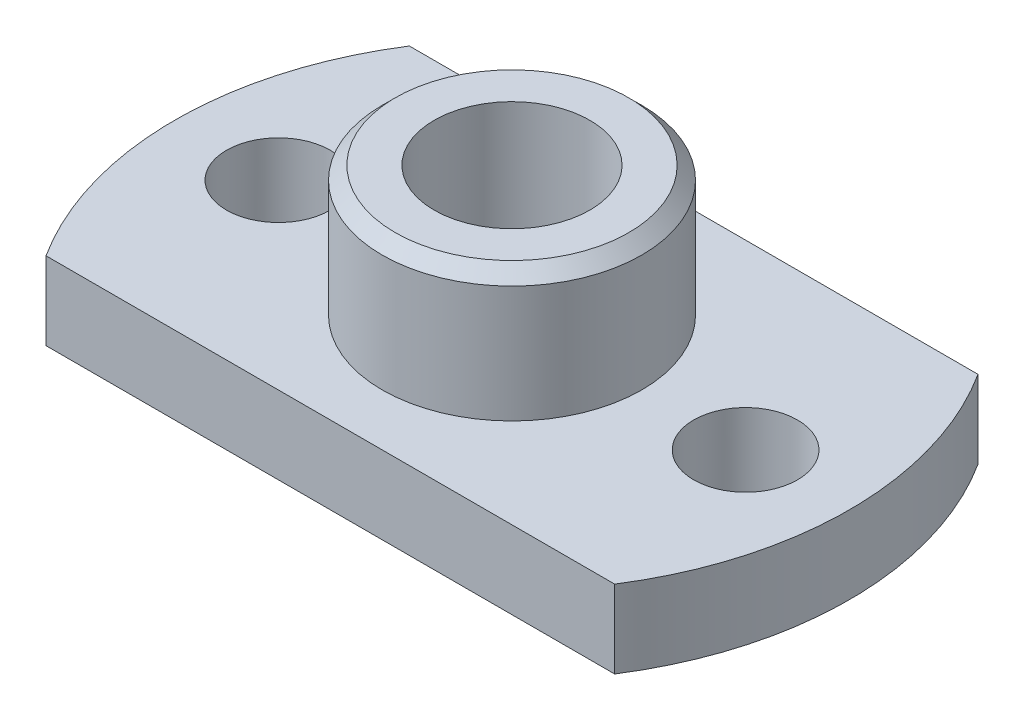
from build123d import *

# Parameters (mm, degrees)
BASE_SKETCH_W              = 10.95445115
BASE_SKETCH_H              = 7
BASE_EXTRUDE_DEPTH         = 1.5
PROTRUSION_START           = 1.5
F_5MM_DIAMETER_SKETCH_R    = 2.5
PROTRUSION_EXTRUDE_DEPTH   = 2.5
F_5MM_DIAMETER_SKETCH_2_R  = 2.5
F_5MM_BOTTOM_CUT_DEPTH     = 0.7
F_2_0_2_DIAMETER_HOLE1_D   = 2
F_2_5_2_5_DIAMETER_HOLE1_D = 2.5
CUT_EXTRUDE2_START         = 4
F_3MM_DIAMETER_SKETCH_R    = 1.5
CUT_EXTRUDE2_DEPTH         = 2.5


with BuildPart() as part:
    # Base Sketch → Base Extrude (new body)
    with BuildSketch(Plane(origin=(0, 0, 0), x_dir=(1, 0, 0), z_dir=(0, 1, 0))):
        Rectangle(BASE_SKETCH_W, BASE_SKETCH_H)
        with BuildLine():
            ThreePointArc((-5.477225575, -3.5), (-6.5, 0), (-5.477225575, 3.5))
            Line((-5.477225575, 3.5), (-5.477225575, -3.5))
        make_face()
        with BuildLine():
            ThreePointArc((5.477225575, 3.5), (6.5, 0), (5.477225575, -3.5))
            Line((5.477225575, -3.5), (5.477225575, 3.5))
        make_face()
    extrude(amount=BASE_EXTRUDE_DEPTH)

    # 5mm diameter Sketch → Protrusion Extrude (add)
    with BuildSketch(Plane(origin=(0, 0, 0), x_dir=(1, 0, 0), z_dir=(0, 1, 0)).offset(PROTRUSION_START)):
        with Locations(Location((0, 0, 0), (0, 0, 270))):
            Circle(F_5MM_DIAMETER_SKETCH_R)
    extrude(amount=PROTRUSION_EXTRUDE_DEPTH)

    # 5mm diameter Sketch<2> → 5mm Bottom Cut (cut)
    with BuildSketch(Plane(origin=(0, 0, 0), x_dir=(1, 0, 0), z_dir=(0, 1, 0))):
        with Locations(Location((0, 0, 0), (0, 0, 270))):
            Circle(F_5MM_DIAMETER_SKETCH_2_R)
    extrude(amount=F_5MM_BOTTOM_CUT_DEPTH, mode=Mode.SUBTRACT)

    # Chamfer1: read off the stored shape, not the designer's step
    # Chamfer1 outline → Chamfer1 (revolve, cut)
    with BuildSketch(Plane.XY):
        Polygon((2.5, 4), (2.25, 4), (2.5, 3.75), align=None)
    revolve(axis=Axis((0, 0, 0), (0, 1, 0)), mode=Mode.SUBTRACT)

    # Ø2.0 (2) Diameter Hole1 (through all)
    with Locations(Plane(origin=(0, 0, 0), x_dir=(-1, 0, 0), z_dir=(0, -1, 0))):
        with Locations((4.5, 0), (-4.5, 0)):
            Hole(F_2_0_2_DIAMETER_HOLE1_D / 2)

    # Ø2.5 (2.5) Diameter Hole1 (through all)
    with Locations(Plane(origin=(0, 0.7, 0), x_dir=(-1, 0, 0), z_dir=(0, -1, 0))):
        with Locations((0, 0)):
            Hole(F_2_5_2_5_DIAMETER_HOLE1_D / 2)

    # 3mm Diameter Sketch → Cut-Extrude2 (cut)
    with BuildSketch(Plane(origin=(0, 0, 0), x_dir=(1, 0, 0), z_dir=(0, 1, 0)).offset(CUT_EXTRUDE2_START)):
        with Locations(Location((0, 0, 0), (0, 0, 270))):
            Circle(F_3MM_DIAMETER_SKETCH_R)
    extrude(amount=-CUT_EXTRUDE2_DEPTH, mode=Mode.SUBTRACT)


solid = part.part
